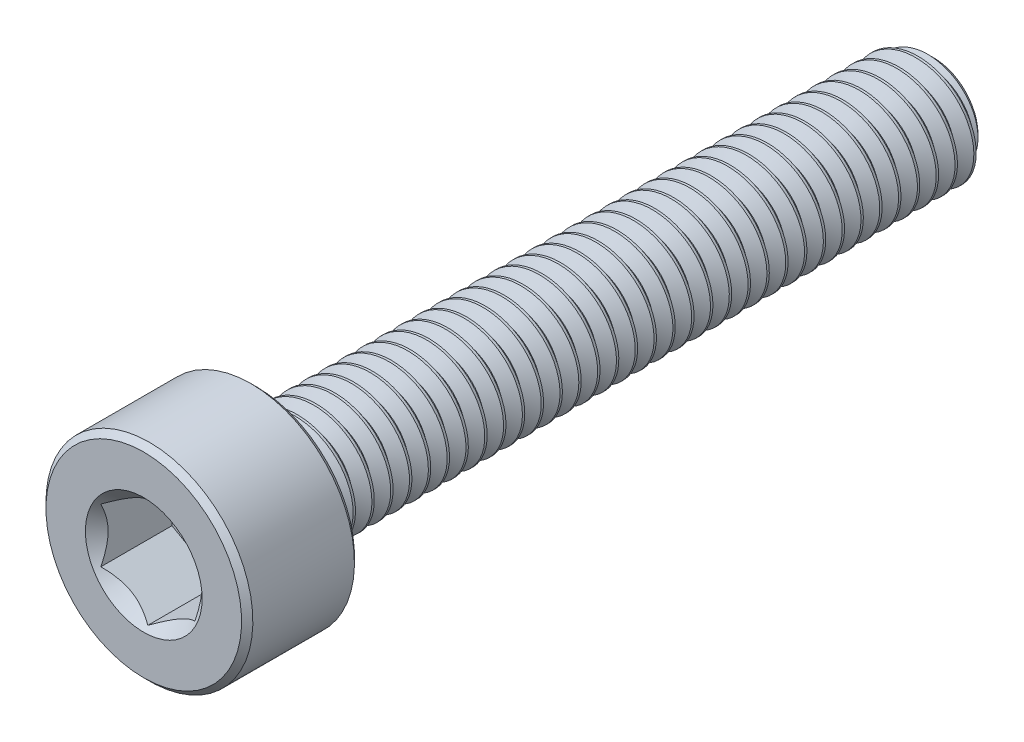
from build123d import *

# Parameters (mm, degrees)
CUT_EXTRUDE1_DEPTH     = 2
SKETCH4_R              = 1.551628848
CUT_EXTRUDE2_DEPTH     = 1.5
CUT_EXTRUDE2_DRAFT     = -45
SPLIT1_SURFACE_1_BACK  = 23.394
SPLIT1_SURFACE_1_DEPTH = 46.788
SPLIT1_SURFACE_2_BACK  = 23.394
SPLIT1_SURFACE_2_DEPTH = 46.788
CUT_SWEEP1_PITCH       = 0.5
CUT_SWEEP1_TO          = 17.85


with BuildPart() as part:
    # Sketch2 → Revolve1 (revolve)
    with BuildSketch(Plane(origin=(0, 0, 0), x_dir=(0, 0, -1), z_dir=(1, 0, 0))):
        with BuildLine():
            Line((-10.5, 0), (-10.5, 2.6))
            Line((-10.5, 2.6), (-10.35, 2.75))
            Line((-10.35, 2.75), (-7.65, 2.75))
            Line((-7.65, 2.75), (-7.5, 2.6))
            Line((-7.5, 2.6), (-7.5, 1.65))
            ThreePointArc((-7.5, 1.65), (-7.456066017, 1.543933983), (-7.35, 1.5))
            Line((-7.35, 1.5), (10.175240474, 1.5))
            Line((10.175240474, 1.5), (10.5, 1.175240474))
            Line((10.5, 1.175240474), (10.5, 0))
            Line((10.5, 0), (-10.5, 0))
        make_face()
    revolve(axis=Axis((0, 0, -10.5), (0, 0, 1)))

    # Sketch3 → Cut-Extrude1 (cut)
    with BuildSketch(Plane.XY.offset(10.5)):
        Polygon((1.25, -0.721687836), (1.25, 0.721687836), (0, 1.443375673), (-1.25, 0.721687836), (-1.25, -0.721687836), (0, -1.443375673), align=None)
    extrude(amount=-CUT_EXTRUDE1_DEPTH, mode=Mode.SUBTRACT)


with BuildPart() as cut_extrude2_tool:
    # Sketch4 → Cut-Extrude2 (with draft: the straight prism first)
    with BuildSketch(Plane.XY.offset(10.5)):
        Circle(SKETCH4_R)
    extrude(amount=-CUT_EXTRUDE2_DEPTH)
    # Cut-Extrude2: the draft: its side faces are tilted about the plane it starts from
    cut_extrude2_sides = [cut_extrude2_tool.faces().sort_by_distance(p)[0] for p in [
        (-1.551628848, 0, 9.75),
    ]]
    draft(cut_extrude2_sides, Plane.XY.offset(10.5), CUT_EXTRUDE2_DRAFT)


with BuildPart() as part_1:
    add(part.part)

    # Cut-Extrude2: cut by cut_extrude2_tool
    add(cut_extrude2_tool.part, mode=Mode.SUBTRACT)


with BuildPart() as body_2:
    # Split1: the piece behind the surface
    add(part_1.part)
    # Split1 surface: a surface, the sketch's curves swept straight by 46.788 mm
    with BuildLine(Plane(origin=(0, 0, 0), x_dir=(0, 0, -1), z_dir=(1, 0, 0)).offset(-SPLIT1_SURFACE_1_BACK), mode=Mode.PRIVATE) as split1_surface_1_path:
        Line((-7.35, -2.75), (-7.35, 2.75))
    split1_surface_1 = Shell.extrude(split1_surface_1_path.wire(), (1 * SPLIT1_SURFACE_1_DEPTH, 0 * SPLIT1_SURFACE_1_DEPTH, 0 * SPLIT1_SURFACE_1_DEPTH))
    split(bisect_by=split1_surface_1, keep=Keep.BOTTOM)

    # Cut-Sweep1: arcs per turn and ends read off the stored shape
    # Cut-Sweep1: the profile of Sketch7 screwed along a right-hand helix through 37 turns, 6 arcs to a turn; built about Z, then put on its axis
    cut_sweep1_z = Axis((0, 0, 0), (0, 0, 1))
    cut_sweep1_corners = [(1.527063294, 0, 0.015625), (1.527063294, 0, -0.453125), (1.175240474, 0, -0.25), (1.175240474, 0, -0.1875)]
    with BuildLine(mode=Mode.PRIVATE) as cut_sweep1_profile:
        Line(cut_sweep1_corners[0], cut_sweep1_corners[1])
        Line(cut_sweep1_corners[1], cut_sweep1_corners[2])
        Line(cut_sweep1_corners[2], cut_sweep1_corners[3])
        Line(cut_sweep1_corners[3], cut_sweep1_corners[0])
    cut_sweep1_cap = Face(cut_sweep1_profile.wire())
    cut_sweep1_turn_angles = [0, 30, 60, 90, 120, 150, 180, 210, 240, 270, 300, 330, 360]
    cut_sweep1_turn_weights = [1, 0.8660254037844387, 1, 0.8660254037844387, 1, 0.8660254037844387, 1, 0.8660254037844387, 1, 0.8660254037844387, 1, 0.8660254037844387, 1]
    cut_sweep1_turn_rails = [Edge.make_bspline([Vector(p[0], p[1], 0).rotate(cut_sweep1_z, cut_sweep1_turn_angles[k]) / cut_sweep1_turn_weights[k] + Vector(0, 0, p[2] + CUT_SWEEP1_PITCH * cut_sweep1_turn_angles[k] / 360) for k in range(13)], [0, 0, 0, 1, 1, 2, 2, 3, 3, 4, 4, 5, 5, 6, 6, 6], 2, cut_sweep1_turn_weights) for p in cut_sweep1_corners]
    cut_sweep1_turn_sides = [Face.make_surface_from_curves(cut_sweep1_turn_rails[p[0]], cut_sweep1_turn_rails[p[1]]) for p in [(0, 1), (1, 2), (2, 3), (3, 0)]]
    cut_sweep1 = Plane(origin=(0, 0, -10.5), x_dir=(0, 1, 0), z_dir=(0, 0, 1)) * split(Solid(Shell([*[p.moved(Location((0, 0, CUT_SWEEP1_PITCH * i))) for i in range(37) for p in cut_sweep1_turn_sides], cut_sweep1_cap, cut_sweep1_cap.rotate(cut_sweep1_z, 13320).moved(Location((0, 0, CUT_SWEEP1_PITCH * 13320 / 360)))])), bisect_by=Plane.XY.offset(CUT_SWEEP1_TO), keep=Keep.BOTTOM, mode=Mode.PRIVATE)
    add(cut_sweep1, mode=Mode.SUBTRACT)


with BuildPart() as part_2:
    add(part_1.part)

    # Split1: split by a surface, the side it looks to stays
    # Split1 surface: a surface, the sketch's curves swept straight by 46.788 mm
    with BuildLine(Plane(origin=(0, 0, 0), x_dir=(0, 0, -1), z_dir=(1, 0, 0)).offset(-SPLIT1_SURFACE_2_BACK), mode=Mode.PRIVATE) as split1_surface_2_path:
        Line((-7.35, -2.75), (-7.35, 2.75))
    split1_surface_2 = Shell.extrude(split1_surface_2_path.wire(), (1 * SPLIT1_SURFACE_2_DEPTH, 0 * SPLIT1_SURFACE_2_DEPTH, 0 * SPLIT1_SURFACE_2_DEPTH))
    split(bisect_by=split1_surface_2, keep=Keep.TOP)

    add(body_2.part)  # Revolve2 merges body 2
    # Sketch8 → Revolve2 (revolve)
    with BuildSketch(Plane(origin=(0, 0, 0), x_dir=(0, 0, -1), z_dir=(1, 0, 0))):
        Polygon((-7.5, 0), (-7.5, 1.5), (-7.35, 1.5), (-6.483974596, 0), align=None)
    revolve(axis=Axis((0, 0, 6.483974596), (0, 0, 1)))


solid = part_2.part
